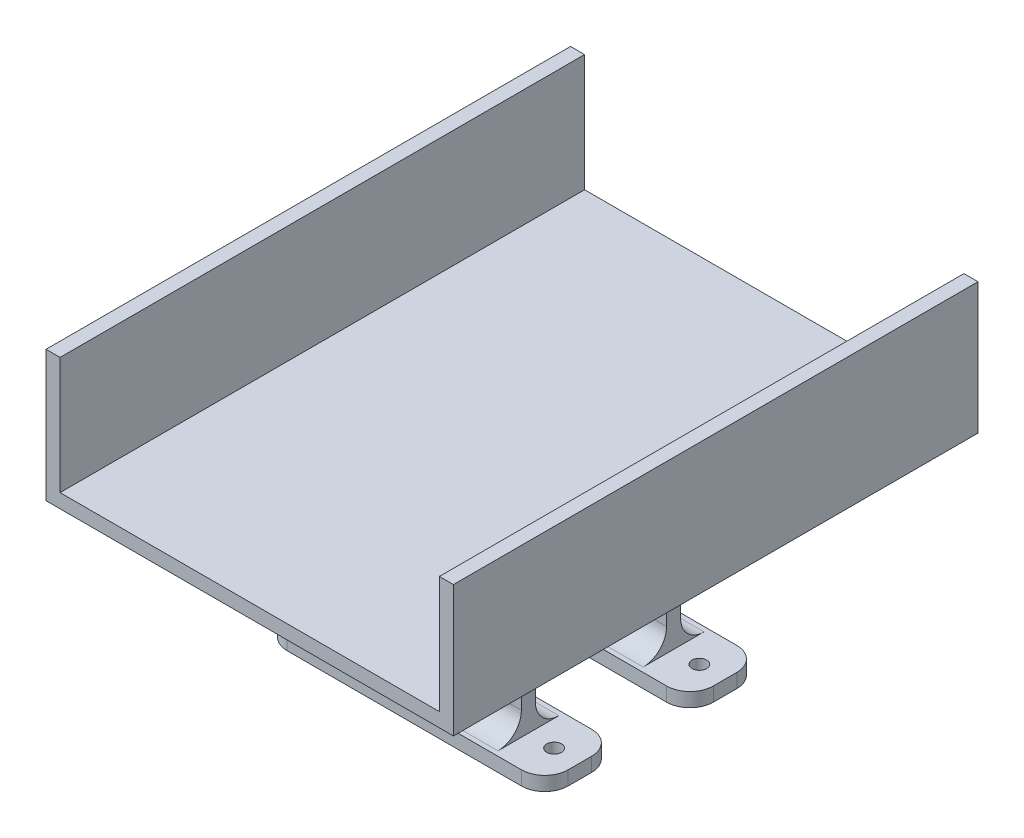
from build123d import *

# Parameters (mm, degrees)
SKETCH1_W             = 87
SKETCH1_H             = 112
BOSS_EXTRUDE1_DEPTH   = 3
SKETCH2_W             = 38
SKETCH2_H             = 3
BOSS_EXTRUDE2_DEPTH   = 32
SKETCH8_W             = 60
SKETCH8_H             = 15
SKETCH8_R             = 1.575
SKETCH8_W_2           = 38
SKETCH8_H_2           = 3
BOSS_EXTRUDE5_DEPTH   = 3
BOSS_EXTRUDE5_2_DEPTH = 3
SKETCH9_W             = 38
SKETCH9_H             = 3
BOSS_EXTRUDE6_DEPTH   = 3
SKETCH10_W            = 38
SKETCH10_H            = 3
BOSS_EXTRUDE7_DEPTH   = 3
FILLET2_R             = 5
FILLET3_R             = 5
FILLET4_R             = 5
SKETCH12_W            = 3
SKETCH12_H            = 112
BOSS_EXTRUDE8_DEPTH   = 25


with BuildPart() as part:
    # Sketch1 → Boss-Extrude1 (new body)
    with BuildSketch(Plane(origin=(0, 0, 0), x_dir=(1, 0, 0), z_dir=(0, 1, 0))):
        Rectangle(SKETCH1_W, SKETCH1_H)
    extrude(amount=BOSS_EXTRUDE1_DEPTH)

    # Sketch2 → Boss-Extrude2 (add)
    with BuildSketch(Plane.XZ):
        with Locations((0, -15.5)):
            Rectangle(SKETCH2_W, SKETCH2_H)
        with Locations((0, 15.5)):
            Rectangle(SKETCH2_W, SKETCH2_H)
    extrude(amount=BOSS_EXTRUDE2_DEPTH)



with BuildPart() as body_2:
    # Sketch8 → Boss-Extrude5 (new body)
    with BuildSketch(Plane.XZ.offset(32)):
        with Locations((0, 15.5)):
            Rectangle(SKETCH8_W, SKETCH8_H)
        with Locations((-24.5, 15.5)):
            Circle(SKETCH8_R, mode=Mode.SUBTRACT)
        with Locations((24.5, 15.5)):
            Circle(SKETCH8_R, mode=Mode.SUBTRACT)
        with Locations((0, 15.5)):
            Rectangle(SKETCH8_W_2, SKETCH8_H_2, mode=Mode.SUBTRACT)
    extrude(amount=BOSS_EXTRUDE5_DEPTH)


with BuildPart() as body_3:
    # Sketch8 → Boss-Extrude5 2 (new body)
    with BuildSketch(Plane.XZ.offset(32)):
        with Locations((0, -15.5)):
            Rectangle(SKETCH8_W, SKETCH8_H)
        with Locations((-24.5, -15.5)):
            Circle(SKETCH8_R, mode=Mode.SUBTRACT)
        with Locations((24.5, -15.5)):
            Circle(SKETCH8_R, mode=Mode.SUBTRACT)
        with Locations((0, -15.5)):
            Rectangle(SKETCH8_W_2, SKETCH8_H_2, mode=Mode.SUBTRACT)
    extrude(amount=BOSS_EXTRUDE5_2_DEPTH)


with BuildPart() as part_1:
    add(part.part)

    add(body_2.part)  # Boss-Extrude6 merges body 2
    # Sketch9 → Boss-Extrude6 (add)
    with BuildSketch(Plane.XY.offset(14)):
        with Locations((0, -33.5)):
            Rectangle(SKETCH9_W, SKETCH9_H)
    extrude(amount=BOSS_EXTRUDE6_DEPTH)


    add(body_3.part)  # Boss-Extrude7 merges body 3
    # Sketch10 → Boss-Extrude7 (add)
    with BuildSketch(Plane(origin=(0, 0, -14), x_dir=(-1, 0, 0), z_dir=(0, 0, -1))):
        with Locations((0, -33.5)):
            Rectangle(SKETCH10_W, SKETCH10_H)
    extrude(amount=BOSS_EXTRUDE7_DEPTH)

    # Fillet2
    fillet2_edges = [part_1.edges().sort_by_distance(p)[0] for p in [
        (30, -33.5, -8),
        (-30, -33.5, -8),
        (30, -33.5, -23),
        (-30, -33.5, -23),
    ]]
    fillet(fillet2_edges, radius=FILLET2_R)

    # Fillet3
    fillet3_edges = [part_1.edges().sort_by_distance(p)[0] for p in [
        (-30, -33.5, 23),
        (30, -33.5, 23),
        (-30, -33.5, 8),
        (30, -33.5, 8),
    ]]
    fillet(fillet3_edges, radius=FILLET3_R)

    # Fillet4
    fillet4_edges = [part_1.edges().sort_by_distance(p)[0] for p in [
        (0, 0, 14),
        (0, 0, 17),
        (0, 0, -14),
        (0, 0, -17),
        (0, -32, 17),
        (0, -32, 14),
        (0, -32, -14),
        (0, -32, -17),
    ]]
    fillet(fillet4_edges, radius=FILLET4_R)

    # Sketch12 → Boss-Extrude8 (add)
    with BuildSketch(Plane(origin=(0, 3, 0), x_dir=(1, 0, 0), z_dir=(0, 1, 0))):
        with Locations((42, 0)):
            Rectangle(SKETCH12_W, SKETCH12_H)
        with Locations((-42, 0)):
            Rectangle(SKETCH12_W, SKETCH12_H)
    extrude(amount=BOSS_EXTRUDE8_DEPTH)


solid = part_1.part
